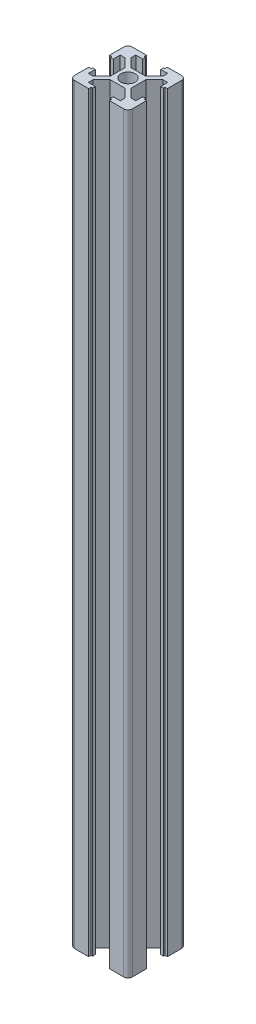
from build123d import *

# Parameters (mm, degrees)
SKETCH_1_R      = 2.5
EXTRUDE_1_DEPTH = 260


with BuildPart() as part:
    # 草图1 → 凸台-拉伸1 (new body)
    with BuildSketch(Plane(origin=(0, 0, 0), x_dir=(1, 0, 0), z_dir=(0, 1, 0))):
        with BuildLine():
            Line((-4.415608984, 3.873972711), (-4.415608984, -1.204706946))
            Line((-4.415608984, -1.204706946), (-7.376269156, -4.165367117))
            Line((-7.376269156, -4.165367117), (-9.015608984, -4.165367117))
            Line((-9.015608984, -4.165367117), (-9.015608984, -1.765367117))
            Line((-9.015608984, -1.765367117), (-10.015608984, -1.765367117))
            Line((-10.015608984, -1.765367117), (-10.015608984, -2.265367117))
            Line((-10.015608984, -2.265367117), (-10.815608984, -2.265367117))
            Line((-10.815608984, -2.265367117), (-10.815608984, -7.165367117))
            ThreePointArc((-10.815608984, -7.165367117), (-10.376269156, -8.226027289), (-9.315608984, -8.665367117))
            Line((-9.315608984, -8.665367117), (-4.415608984, -8.665367117))
            Line((-4.415608984, -8.665367117), (-4.415608984, -7.865367117))
            Line((-4.415608984, -7.865367117), (-3.915608984, -7.865367117))
            Line((-3.915608984, -7.865367117), (-3.915608984, -6.865367117))
            Line((-3.915608984, -6.865367117), (-6.315608984, -6.865367117))
            Line((-6.315608984, -6.865367117), (-6.315608984, -5.226027289))
            Line((-6.315608984, -5.226027289), (-3.354948812, -2.265367117))
            Line((-3.354948812, -2.265367117), (1.723730844, -2.265367117))
            Line((1.723730844, -2.265367117), (4.684391016, -5.226027289))
            Line((4.684391016, -5.226027289), (4.684391016, -6.865367117))
            Line((4.684391016, -6.865367117), (2.284391016, -6.865367117))
            Line((2.284391016, -6.865367117), (2.284391016, -7.865367117))
            Line((2.284391016, -7.865367117), (2.784391016, -7.865367117))
            Line((2.784391016, -7.865367117), (2.784391016, -8.665367117))
            Line((2.784391016, -8.665367117), (7.684391016, -8.665367117))
            ThreePointArc((7.684391016, -8.665367117), (8.745051188, -8.226027289), (9.184391016, -7.165367117))
            Line((9.184391016, -7.165367117), (9.184391016, -2.265367117))
            Line((9.184391016, -2.265367117), (8.384391016, -2.265367117))
            Line((8.384391016, -2.265367117), (8.384391016, -1.765367117))
            Line((8.384391016, -1.765367117), (7.384391016, -1.765367117))
            Line((7.384391016, -1.765367117), (7.384391016, -4.165367117))
            Line((7.384391016, -4.165367117), (5.745051188, -4.165367117))
            Line((5.745051188, -4.165367117), (2.784391016, -1.204706946))
            Line((2.784391016, -1.204706946), (2.784391016, 3.873972711))
            Line((2.784391016, 3.873972711), (5.745051188, 6.834632883))
            Line((5.745051188, 6.834632883), (7.384391016, 6.834632883))
            Line((7.384391016, 6.834632883), (7.384391016, 4.434632883))
            Line((7.384391016, 4.434632883), (8.384391016, 4.434632883))
            Line((8.384391016, 4.434632883), (8.384391016, 4.934632883))
            Line((8.384391016, 4.934632883), (9.184391016, 4.934632883))
            Line((9.184391016, 4.934632883), (9.184391016, 9.834632883))
            ThreePointArc((9.184391016, 9.834632883), (8.745051188, 10.895293054), (7.684391016, 11.334632883))
            Line((7.684391016, 11.334632883), (2.784391016, 11.334632883))
            Line((2.784391016, 11.334632883), (2.784391016, 10.534632883))
            Line((2.784391016, 10.534632883), (2.284391016, 10.534632883))
            Line((2.284391016, 10.534632883), (2.284391016, 9.534632883))
            Line((2.284391016, 9.534632883), (4.684391016, 9.534632883))
            Line((4.684391016, 9.534632883), (4.684391016, 7.895293054))
            Line((4.684391016, 7.895293054), (1.723730844, 4.934632883))
            Line((1.723730844, 4.934632883), (-3.354948812, 4.934632883))
            Line((-3.354948812, 4.934632883), (-6.315608984, 7.895293054))
            Line((-6.315608984, 7.895293054), (-6.315608984, 9.534632883))
            Line((-6.315608984, 9.534632883), (-3.915608984, 9.534632883))
            Line((-3.915608984, 9.534632883), (-3.915608984, 10.534632883))
            Line((-3.915608984, 10.534632883), (-4.415608984, 10.534632883))
            Line((-4.415608984, 10.534632883), (-4.415608984, 11.334632883))
            Line((-4.415608984, 11.334632883), (-9.315608984, 11.334632883))
            ThreePointArc((-9.315608984, 11.334632883), (-10.376269156, 10.895293054), (-10.815608984, 9.834632883))
            Line((-10.815608984, 9.834632883), (-10.815608984, 4.934632883))
            Line((-10.815608984, 4.934632883), (-10.015608984, 4.934632883))
            Line((-10.015608984, 4.934632883), (-10.015608984, 4.434632883))
            Line((-10.015608984, 4.434632883), (-9.015608984, 4.434632883))
            Line((-9.015608984, 4.434632883), (-9.015608984, 6.834632883))
            Line((-9.015608984, 6.834632883), (-7.376269156, 6.834632883))
            Line((-7.376269156, 6.834632883), (-4.415608984, 3.873972711))
        make_face()
        with Locations((-0.815608984, 1.334632883)):
            Circle(SKETCH_1_R, mode=Mode.SUBTRACT)
    extrude(amount=EXTRUDE_1_DEPTH)


solid = part.part
